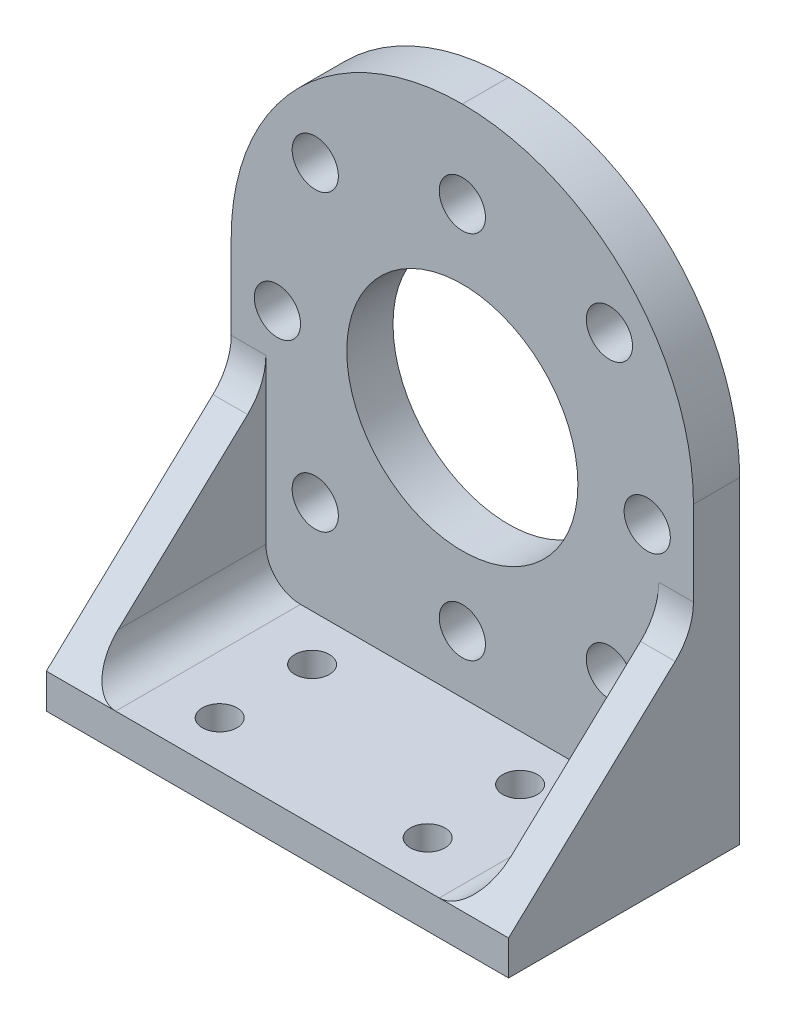
from build123d import *

# Parameters (mm, degrees)
SKETCH_1_W          = 40
SKETCH_1_H          = 20
EXTRUDE_1_DEPTH     = 3
SKETCH_2_W          = 40
SKETCH_2_H          = 4
EXTRUDE_2_DEPTH     = 44.5
SKETCH_3_R          = 10
SKETCH_3_R_2        = 2
CUT_EXTRUDE_1_DEPTH = 54.965266607
FILLET_1_R          = 20
SKETCH_4_W          = 3
SKETCH_4_H          = 16
EXTRUDE_3_DEPTH     = 15
CUT_EXTRUDE_2_DEPTH = 63.898728127
FILLET_2_R          = 5
FILLET_3_R          = 3
SKETCH_6_R          = 1.5
CUT_EXTRUDE_3_DEPTH = 3
SKETCH_7_R          = 2
CUT_EXTRUDE_4_DEPTH = 54.965266607


with BuildPart() as part:
    # 草图1 → 凸台-拉伸1 (new body)
    with BuildSketch(Plane(origin=(0, 0, 0), x_dir=(1, 0, 0), z_dir=(0, 1, 0))):
        Rectangle(SKETCH_1_W, SKETCH_1_H)
    extrude(amount=EXTRUDE_1_DEPTH)

    # 草图2 → 凸台-拉伸2 (add)
    with BuildSketch(Plane(origin=(0, 3, 0), x_dir=(1, 0, 0), z_dir=(0, 1, 0))):
        with Locations((0, 8)):
            Rectangle(SKETCH_2_W, SKETCH_2_H)
    extrude(amount=EXTRUDE_2_DEPTH)

    # 草图3 → 切除-拉伸1 (cut, through all)
    with BuildSketch(Plane.XY.offset(-6)):
        with Locations((0, 24)):
            Circle(SKETCH_3_R)
        with Locations((12.727922061, 36.727922061)):
            Circle(SKETCH_3_R_2)
        with Locations((12.727922061, 11.272077939)):
            Circle(SKETCH_3_R_2)
        with Locations((-12.727922061, 11.272077939)):
            Circle(SKETCH_3_R_2)
        with Locations((-12.727922061, 36.727922061)):
            Circle(SKETCH_3_R_2)
    extrude(amount=-CUT_EXTRUDE_1_DEPTH, mode=Mode.SUBTRACT)

    # 圆角1
    fillet_1_edges = [part.edges().sort_by_distance(p)[0] for p in [
        (20, 47.5, -8),
        (-20, 47.5, -8),
    ]]
    fillet(fillet_1_edges, radius=FILLET_1_R - 0.0001)  # a hair under: the kernel refuses the full size

    # 草图4 → 凸台-拉伸3 (add)
    with BuildSketch(Plane(origin=(0, 3, 0), x_dir=(1, 0, 0), z_dir=(0, 1, 0))):
        with Locations((-18.5, -2)):
            Rectangle(SKETCH_4_W, SKETCH_4_H)
        with Locations((18.5, -2)):
            Rectangle(SKETCH_4_W, SKETCH_4_H)
    extrude(amount=EXTRUDE_3_DEPTH)

    # 草图5 → 切除-拉伸2 (cut, through all)
    with BuildSketch(Plane.ZY.offset(20)):
        Polygon((-6, 18), (10, 3), (10, 18), align=None)
    extrude(amount=-CUT_EXTRUDE_2_DEPTH, mode=Mode.SUBTRACT)

    # 圆角2
    fillet_2_edges = [part.edges().sort_by_distance(p)[0] for p in [
        (-18.5, 18, -6),
        (18.5, 18, -6),
    ]]
    fillet(fillet_2_edges, radius=FILLET_2_R)

    # 圆角3
    fillet_3_edges = [part.edges().sort_by_distance(p)[0] for p in [
        (-17, 3, 2),
        (17, 3, 2),
    ]]
    fillet(fillet_3_edges, radius=FILLET_3_R)

    # 草图6 → 切除-拉伸3 (cut)
    with BuildSketch(Plane(origin=(0, 3, 0), x_dir=(1, 0, 0), z_dir=(0, 1, 0))):
        with Locations(Location((-9, 2, 0), (0, 0, 270))):
            Circle(SKETCH_6_R)
        with Locations(Location((9, 2, 0), (0, 0, 90))):
            Circle(SKETCH_6_R)
        with Locations(Location((9, -6, 0), (0, 0, 270))):
            Circle(SKETCH_6_R)
        with Locations(Location((-9, -6, 0), (0, 0, 90))):
            Circle(SKETCH_6_R)
    extrude(amount=-CUT_EXTRUDE_3_DEPTH, mode=Mode.SUBTRACT)

    # 草图7 → 切除-拉伸4 (cut, through all)
    with BuildSketch(Plane.XY.offset(-6)):
        with Locations((0, 40)):
            Circle(SKETCH_7_R)
        with Locations((-16, 24)):
            Circle(SKETCH_7_R)
        with Locations((0, 8)):
            Circle(SKETCH_7_R)
        with Locations((16, 24)):
            Circle(SKETCH_7_R)
    extrude(amount=-CUT_EXTRUDE_4_DEPTH, mode=Mode.SUBTRACT)


solid = part.part
